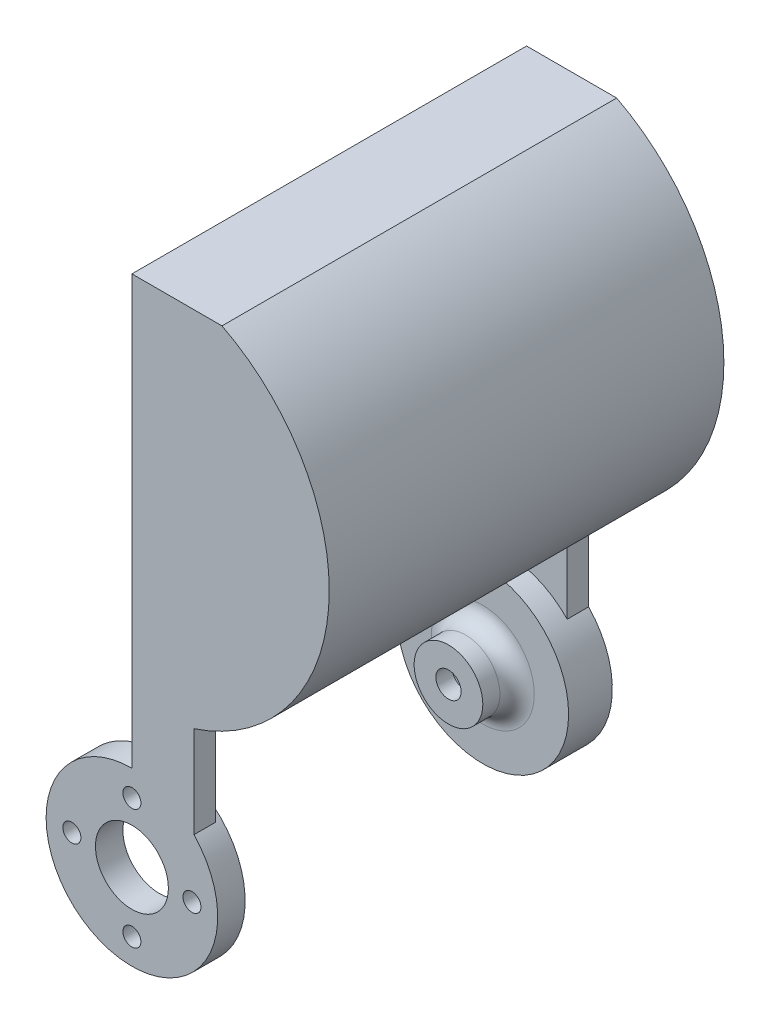
from build123d import *
from build123d.topology import SkipClean

# Parameters (mm, degrees)
BOSS_EXTRUDE1_DEPTH = 23
BOSS_EXTRUDE3_DEPTH = 2
SKETCH4_W           = 20
SKETCH4_H           = 41
CUT_EXTRUDE1_DEPTH  = 18.2
SKETCH5_R           = 10
SKETCH5_R_2         = 4.25
BOSS_EXTRUDE4_DEPTH = 0.7
CUT_EXTRUDE2_REACH  = 80.949
SKETCH6_R           = 1.05
SKETCH6_R_2         = 4.25
BOSS_EXTRUDE5_START = 6.1
SKETCH7_R           = 10
BOSS_EXTRUDE5_DEPTH = 6.1
SKETCH11_R          = 4
BOSS_EXTRUDE6_DEPTH = 0.5
SKETCH10_R          = 3
CUT_EXTRUDE4_DEPTH  = 7.2
CUT_EXTRUDE3_REACH  = 80.949
SKETCH9_R           = 1.475
SKETCH12_R          = 5
CUT_EXTRUDE5_DEPTH  = 4
SKETCH13_R          = 10
SKETCH13_R_2        = 4
CUT_EXTRUDE6_DEPTH  = 3.5
FILLET2_R           = 2


with BuildPart() as part:
    # Sketch1 → Boss-Extrude1 (new, symmetric)
    with BuildSketch(Plane.XY):
        with BuildLine():
            Line((10.5, 59.9), (0, 59.9))
            Line((0, 59.9), (16.889174661, 50.149030463))
            ThreePointArc((16.889174661, 50.149030463), (17.524957173, 29.799404984), (0, 19.43661807))
            Line((0, 19.43661807), (0, 10))
            ThreePointArc((0, 10), (-3.934485272, -9.193466465), (7.234311682, 6.903965128))
            Line((7.234311682, 6.903965128), (7.234311682, 17.603965128))
            ThreePointArc((7.234311682, 17.603965128), (22.931748607, 37.666051544), (10.5, 59.9))
        make_face()
    extrude(amount=BOSS_EXTRUDE1_DEPTH, both=True)

    # Sketch3 → Boss-Extrude3 (add)
    with BuildSketch(Plane.XY.offset(23)):
        with BuildLine():
            Line((0, 59.9), (0, 19.43661807))
            ThreePointArc((0, 19.43661807), (17.524957173, 29.799404984), (16.889174661, 50.149030463))
            Line((16.889174661, 50.149030463), (0, 59.9))
        make_face()
    boss_extrude3 = extrude(amount=-BOSS_EXTRUDE3_DEPTH)

    # Mirror1: Boss-Extrude3 across plane
    add(boss_extrude3.mirror(Plane.XY))

    # Sketch4 → Cut-Extrude1 (cut, symmetric)
    with BuildSketch(Plane(origin=(0, 0, 0), x_dir=(1, 0, 0), z_dir=(0, 1, 0))):
        Rectangle(SKETCH4_W, SKETCH4_H)
    extrude(amount=CUT_EXTRUDE1_DEPTH, both=True, mode=Mode.SUBTRACT)

    # Sketch5 → Boss-Extrude4 (add)
    with SkipClean():  # the faces are left unmerged after this step: merging them gives an invalid solid
        with BuildSketch(Plane(origin=(0, 0, 20.5), x_dir=(-1, 0, 0), z_dir=(0, 0, -1))):
            Circle(SKETCH5_R)
            Circle(SKETCH5_R_2, mode=Mode.SUBTRACT)
        extrude(amount=BOSS_EXTRUDE4_DEPTH)

    # Sketch6 → Cut-Extrude2 (cut, up to next)
    with BuildSketch(Plane.XY.offset(23), mode=Mode.PRIVATE) as cut_extrude2_sk1:
        with Locations((0, 7)):
            Circle(SKETCH6_R)
    cut_extrude2_tool1 = extrude(cut_extrude2_sk1.sketch, amount=-CUT_EXTRUDE2_REACH, mode=Mode.PRIVATE) & part.part
    # Sketch6 → Cut-Extrude2 (cut, up to next)
    with BuildSketch(Plane.XY.offset(23), mode=Mode.PRIVATE) as cut_extrude2_sk2:
        with Locations((7, 0)):
            Circle(SKETCH6_R)
    cut_extrude2_tool2 = extrude(cut_extrude2_sk2.sketch, amount=-CUT_EXTRUDE2_REACH, mode=Mode.PRIVATE) & part.part
    # Sketch6 → Cut-Extrude2 (cut, up to next)
    with BuildSketch(Plane.XY.offset(23), mode=Mode.PRIVATE) as cut_extrude2_sk3:
        with Locations((0, -7)):
            Circle(SKETCH6_R)
    cut_extrude2_tool3 = extrude(cut_extrude2_sk3.sketch, amount=-CUT_EXTRUDE2_REACH, mode=Mode.PRIVATE) & part.part
    # Sketch6 → Cut-Extrude2 (cut, up to next)
    with BuildSketch(Plane.XY.offset(23), mode=Mode.PRIVATE) as cut_extrude2_sk4:
        with Locations((-7, 0)):
            Circle(SKETCH6_R)
    cut_extrude2_tool4 = extrude(cut_extrude2_sk4.sketch, amount=-CUT_EXTRUDE2_REACH, mode=Mode.PRIVATE) & part.part
    # Sketch6 → Cut-Extrude2 (cut, up to next)
    with BuildSketch(Plane.XY.offset(23), mode=Mode.PRIVATE) as cut_extrude2_sk5:
        Circle(SKETCH6_R_2)
    cut_extrude2_tool5 = extrude(cut_extrude2_sk5.sketch, amount=-CUT_EXTRUDE2_REACH, mode=Mode.PRIVATE) & part.part
    add(cut_extrude2_tool1.solids().sort_by_distance((0, 7, 23))[0], mode=Mode.SUBTRACT)
    add(cut_extrude2_tool2.solids().sort_by_distance((7, 0, 23))[0], mode=Mode.SUBTRACT)
    add(cut_extrude2_tool3.solids().sort_by_distance((0, -7, 23))[0], mode=Mode.SUBTRACT)
    add(cut_extrude2_tool4.solids().sort_by_distance((-7, 0, 23))[0], mode=Mode.SUBTRACT)
    add(cut_extrude2_tool5.solids().sort_by_distance((0, 0, 23))[0], mode=Mode.SUBTRACT)

    # Sketch7 → Boss-Extrude5 (add)
    with SkipClean():  # the faces are left unmerged after this step: merging them gives an invalid solid
        with BuildSketch(Plane.XY.offset(-20.5).offset(BOSS_EXTRUDE5_START)):
            Circle(SKETCH7_R)
        extrude(amount=-BOSS_EXTRUDE5_DEPTH)

    # Sketch11 → Boss-Extrude6 (add)
    with SkipClean():  # the faces are left unmerged after this step: merging them gives an invalid solid
        with BuildSketch(Plane.XY.offset(-14.4)):
            Circle(SKETCH11_R)
        extrude(amount=BOSS_EXTRUDE6_DEPTH)

    # Sketch10 → Cut-Extrude4 (cut)
    with SkipClean():  # the faces are left unmerged after this step: merging them gives an invalid solid
        with BuildSketch(Plane(origin=(0, 0, -23), x_dir=(-1, 0, 0), z_dir=(0, 0, -1))):
            Circle(SKETCH10_R)
        extrude(amount=-CUT_EXTRUDE4_DEPTH, mode=Mode.SUBTRACT)

    # Sketch9 → Cut-Extrude3 (cut, up to next)
    with BuildSketch(Plane(origin=(0, 0, -23), x_dir=(-1, 0, 0), z_dir=(0, 0, -1)), mode=Mode.PRIVATE) as cut_extrude3_sk1:
        Circle(SKETCH9_R)
    cut_extrude3_tool1 = extrude(cut_extrude3_sk1.sketch, amount=-CUT_EXTRUDE3_REACH, mode=Mode.PRIVATE) & part.part
    add(cut_extrude3_tool1.solids().sort_by_distance((0, 0, -23))[0], mode=Mode.SUBTRACT)

    # Sketch12 → Cut-Extrude5 (cut)
    with SkipClean():  # the faces are left unmerged after this step: merging them gives an invalid solid
        with BuildSketch(Plane(origin=(0, 0, -23), x_dir=(-1, 0, 0), z_dir=(0, 0, -1))):
            Circle(SKETCH12_R)
        extrude(amount=-CUT_EXTRUDE5_DEPTH, mode=Mode.SUBTRACT)

    # Sketch13 → Cut-Extrude6 (cut)
    with SkipClean():  # the faces are left unmerged after this step: merging them gives an invalid solid
        with BuildSketch(Plane.XY.offset(-14.4)):
            Circle(SKETCH13_R)
            Circle(SKETCH13_R_2, mode=Mode.SUBTRACT)
        extrude(amount=-CUT_EXTRUDE6_DEPTH, mode=Mode.SUBTRACT)

    # Fillet2
    fillet2_edges = [part.edges().sort_by_distance(p)[0] for p in [
        (-4, 0, -17.9),
    ]]
    fillet(fillet2_edges, radius=FILLET2_R)


solid = part.part
